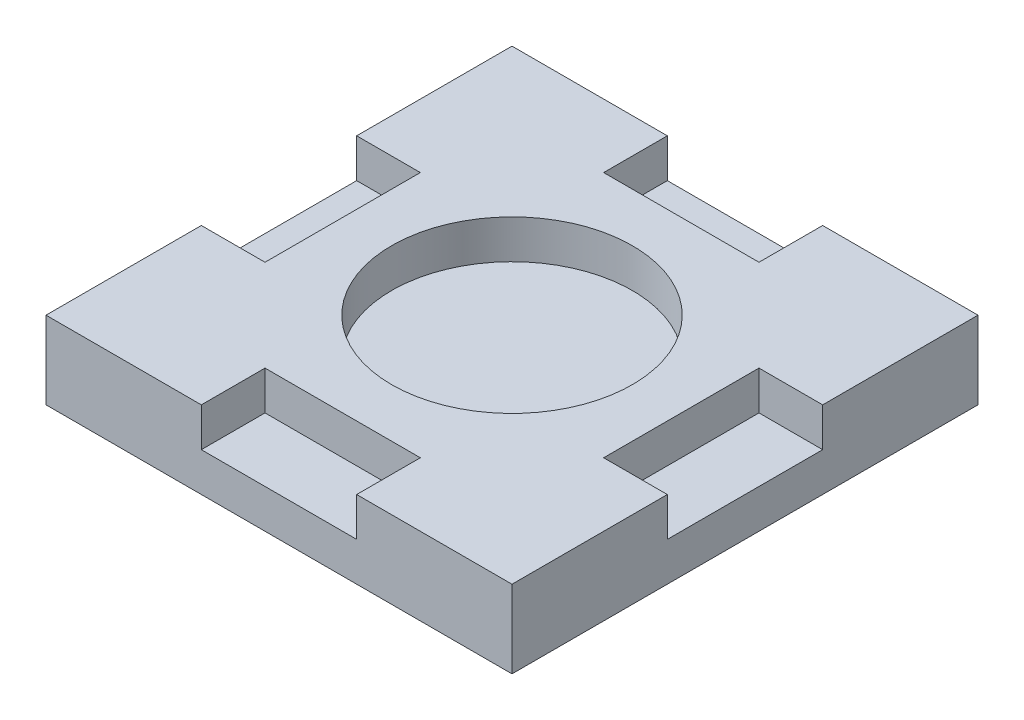
from build123d import *

# Parameters (mm, degrees)
SKETCH1_W           = 76.2
SKETCH1_H           = 76.2
BOSS_EXTRUDE1_DEPTH = 12.7
SKETCH2_W           = 25.4
SKETCH2_H           = 10.414
SKETCH2_W_2         = 10.414
SKETCH2_H_2         = 25.4
CUT_EXTRUDE1_DEPTH  = 6.35
SKETCH3_R           = 19.685
CUT_EXTRUDE2_DEPTH  = 6.35


with BuildPart() as part:
    # Sketch1 → Boss-Extrude1 (new body)
    with BuildSketch(Plane(origin=(0, 0, 0), x_dir=(1, 0, 0), z_dir=(0, 1, 0))):
        with Locations((38.1, 38.1)):
            Rectangle(SKETCH1_W, SKETCH1_H)
    extrude(amount=BOSS_EXTRUDE1_DEPTH)

    # Sketch2 → Cut-Extrude1 (cut)
    with BuildSketch(Plane(origin=(0, 12.7, 0), x_dir=(1, 0, 0), z_dir=(0, 1, 0))):
        with Locations((38.1, 70.993)):
            Rectangle(SKETCH2_W, SKETCH2_H)
        with Locations((5.207, 38.1)):
            Rectangle(SKETCH2_W_2, SKETCH2_H_2)
        with Locations((38.1, 5.207)):
            Rectangle(SKETCH2_W, SKETCH2_H)
        with Locations((70.993, 38.1)):
            Rectangle(SKETCH2_W_2, SKETCH2_H_2)
    extrude(amount=-CUT_EXTRUDE1_DEPTH, mode=Mode.SUBTRACT)

    # Sketch3 → Cut-Extrude2 (cut)
    with BuildSketch(Plane(origin=(0, 12.7, 0), x_dir=(1, 0, 0), z_dir=(0, 1, 0))):
        with Locations((38.1, 38.1)):
            Circle(SKETCH3_R)
    extrude(amount=-CUT_EXTRUDE2_DEPTH, mode=Mode.SUBTRACT)


solid = part.part
